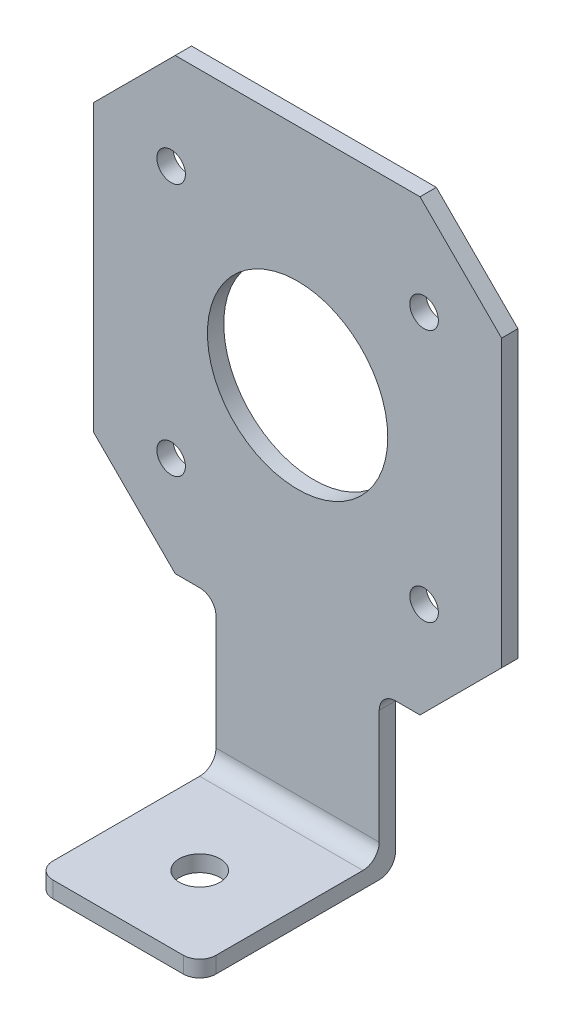
from build123d import *

# Parameters (mm, degrees)
SCHIZZO1_R                   = 1.75
SCHIZZO1_R_2                 = 11.05
ESTRUSIONE_ESTRUSIONE1_DEPTH = 2
SCHIZZO14_W                  = 20
SCHIZZO14_H                  = 2
ESTRUSIONE_ESTRUSIONE2_DEPTH = 22
SCHIZZO15_R                  = 2.5
TAGLIO_ESTRUSIONE1_DEPTH     = 10
SMUSSO1_SIZE                 = 10
RACCORDO1_R                  = 2


with BuildPart() as part:
    # Schizzo1 → Estrusione-Estrusione1 (new body)
    with BuildSketch(Plane.XY):
        Polygon((-25, -27.5), (-10, -27.5), (-10, -47.5), (10, -47.5), (10, -27.5), (25, -27.5), (25, 27.5), (-25, 27.5), align=None)
        with Locations((-15.5, 15.5)):
            Circle(SCHIZZO1_R, mode=Mode.SUBTRACT)
        with Locations((15.5, 15.5)):
            Circle(SCHIZZO1_R, mode=Mode.SUBTRACT)
        with Locations((15.5, -15.5)):
            Circle(SCHIZZO1_R, mode=Mode.SUBTRACT)
        with Locations((-15.5, -15.5)):
            Circle(SCHIZZO1_R, mode=Mode.SUBTRACT)
        Circle(SCHIZZO1_R_2, mode=Mode.SUBTRACT)
    extrude(amount=ESTRUSIONE_ESTRUSIONE1_DEPTH)

    # Schizzo14 → Estrusione-Estrusione2 (add)
    with BuildSketch(Plane.XY.offset(2)):
        with Locations((0, -46.5)):
            Rectangle(SCHIZZO14_W, SCHIZZO14_H)
    extrude(amount=ESTRUSIONE_ESTRUSIONE2_DEPTH)

    # Schizzo15 → Taglio-Estrusione1 (cut)
    with BuildSketch(Plane(origin=(0, -45.5, 0), x_dir=(1, 0, 0), z_dir=(0, 1, 0))):
        with Locations((0, -14)):
            Circle(SCHIZZO15_R)
    extrude(amount=-TAGLIO_ESTRUSIONE1_DEPTH, mode=Mode.SUBTRACT)

    # Smusso1
    smusso1_edges = [part.edges().sort_by_distance(p)[0] for p in [
        (25, -27.5, 1),
        (-25, -27.5, 1),
        (-25, 27.5, 1),
        (25, 27.5, 1),
    ]]
    chamfer(smusso1_edges, length=SMUSSO1_SIZE)

    # Raccordo1
    raccordo1_edges = [part.edges().sort_by_distance(p)[0] for p in [
        (10, -46.5, 24),
        (-10, -46.5, 24),
        (0, -45.5, 2),
        (0, -47.5, 0),
        (-10, -27.5, 1),
        (10, -27.5, 1),
    ]]
    fillet(raccordo1_edges, radius=RACCORDO1_R)


solid = part.part
